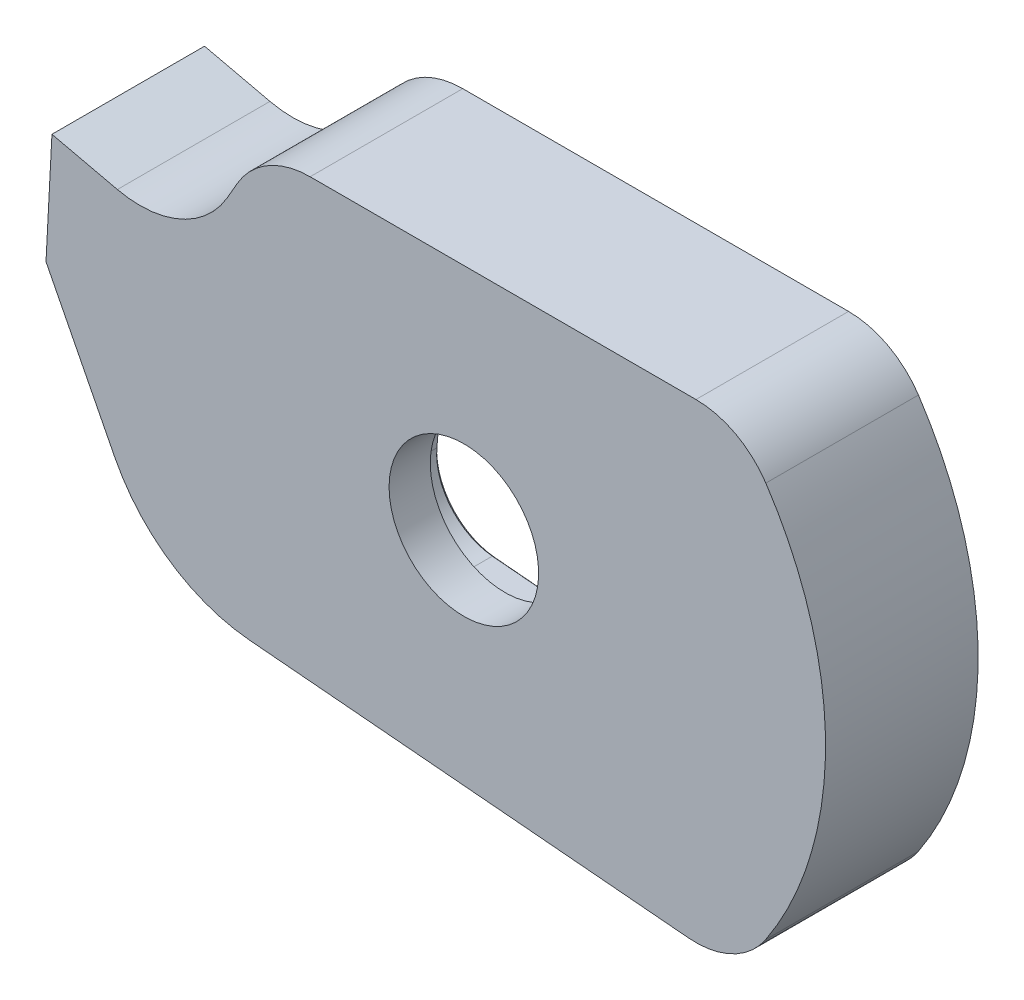
from build123d import *

# Parameters (mm, degrees)
EXTRUS_O_GEOMETRIA_DEPTH = 50
REBAIXO_CAMISA_DEPTH     = 36.5
ESBO_O2_3_R              = 24.5
FURO_EIXO_DEPTH          = 167.249885943
CHANFRO_CAMISA_SIZE      = 1


with BuildPart() as part:
    # Sketch2 → EXTRUSÃO GEOMETRIA (new body)
    with BuildSketch(Plane.XY):
        with BuildLine():
            Line((-115.160264549, 41.801076804), (-136.596405974, 46.75))
            Line((-136.596405974, 46.75), (-138.54204478, 9.625))
            Line((-138.54204478, 9.625), (-116.006850664, -34.602808715))
            ThreePointArc((-116.006850664, -34.602808715), (-97.757101525, -55.23039772), (-71.795057685, -64.424039624))
            Line((-71.795057685, -64.424039624), (71.948827165, -77))
            ThreePointArc((71.948827165, -77), (86.247034502, -74.395896215), (97.221182427, -64.867613742))
            ThreePointArc((97.221182427, -64.867613742), (116.874971083, -0.082215638), (97.312348342, 64.730769231))
            ThreePointArc((97.312348342, 64.730769231), (87.403855646, 73.739391018), (74.415325203, 77))
            Line((74.415325203, 77), (-51.996764837, 77))
            ThreePointArc((-51.996764837, 77), (-65.746764837, 73.315698604), (-75.812463441, 63.25))
            Line((-75.812463441, 63.25), (-79.15804143, 57.455288942))
            ThreePointArc((-79.15804143, 57.455288942), (-94.578160481, 43.692306488), (-115.160264549, 41.801076804))
        make_face()
    extrude(amount=EXTRUS_O_GEOMETRIA_DEPTH)

    # Esboço2 → REBAIXO CAMISA (cut)
    with BuildSketch(Plane(origin=(0, 0, 0), x_dir=(-1, 0, 0), z_dir=(0, 0, -1))):
        with BuildLine():
            Line((-38.023575577, 53.678047914), (31.710053289, 59.778949906))
            ThreePointArc((31.710053289, 59.778949906), (46.308920338, 55.175944807), (53.377062106, 41.5981708))
            Line((53.377062106, 41.5981708), (59.477964098, -28.135458067))
            ThreePointArc((59.477964098, -28.135458067), (54.874958999, -42.734325116), (41.297184991, -49.802466884))
            Line((41.297184991, -49.802466884), (-28.436443875, -55.903368876))
            ThreePointArc((-28.436443875, -55.903368876), (-43.035310924, -51.300363777), (-50.103452692, -37.722589769))
            Line((-50.103452692, -37.722589769), (-56.204354684, 32.011039097))
            ThreePointArc((-56.204354684, 32.011039097), (-51.601349585, 46.609906146), (-38.023575577, 53.678047914))
        make_face()
    extrude(amount=-REBAIXO_CAMISA_DEPTH, mode=Mode.SUBTRACT)

    # Esboço2<3> → FURO EIXO (cut, through all)
    with BuildSketch(Plane(origin=(0, 0, 0), x_dir=(-1, 0, 0), z_dir=(0, 0, -1))):
        with Locations((1.636804707, 1.937790515)):
            Circle(ESBO_O2_3_R)
    extrude(amount=-FURO_EIXO_DEPTH, mode=Mode.SUBTRACT)

    # CHANFRO CAMISA
    chanfro_camisa_edges = [part.edges().sort_by_distance(p)[0] for p in [
        (-6.430370558, -52.85291788, 0),
        (43.035310924, -51.300363777, 0),
        (-54.874958999, -42.734325116, 0),
        (53.153903688, -2.855775336, 0),
        (-56.427513102, 6.731356366, 0),
        (51.601349585, 46.609906146, 0),
        (-46.308920338, 55.175944807, 0),
        (3.156761144, 56.72849891, 0),
    ]]
    chamfer(chanfro_camisa_edges, length=CHANFRO_CAMISA_SIZE)


solid = part.part
